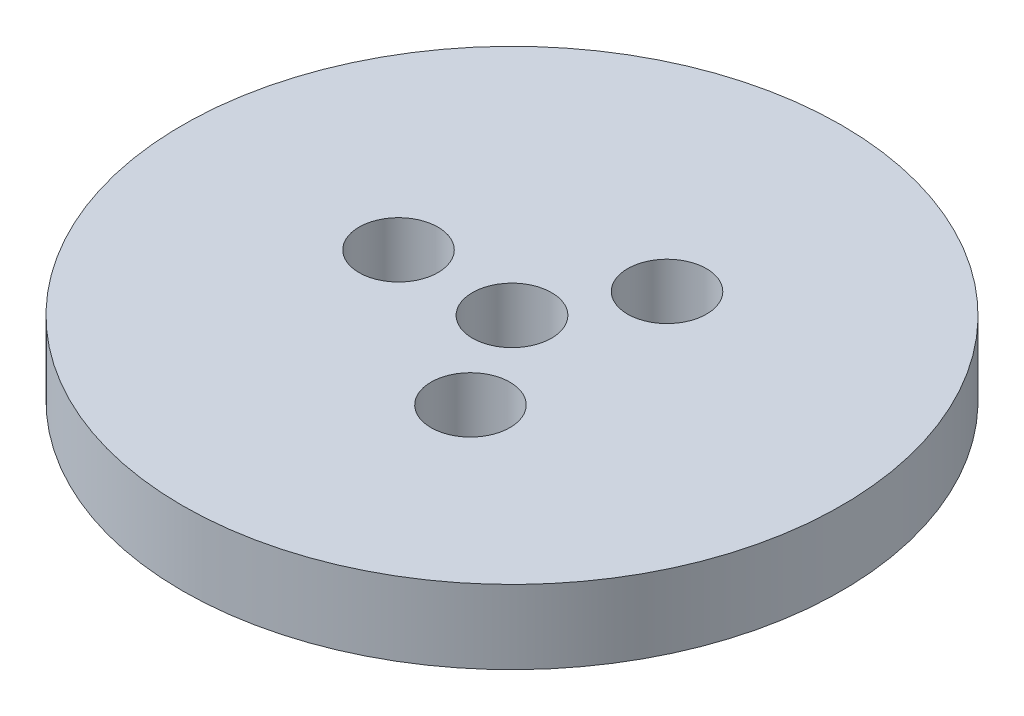
from build123d import *

# Parameters (mm, degrees)
SKETCH1_R           = 62.5
BOSS_EXTRUDE1_DEPTH = 14
SKETCH2_R           = 7.5
CUT_EXTRUDE1_DEPTH  = 90.49022293
SKETCH3_R           = 7.483126217
CUT_EXTRUDE2_DEPTH  = 13.000433881
CIRPATTERN1_COUNT   = 3


with BuildPart() as part:
    # Sketch1 → Boss-Extrude1 (new body)
    with BuildSketch(Plane(origin=(0, 0, 0), x_dir=(1, 0, 0), z_dir=(0, 1, 0))):
        Circle(SKETCH1_R)
    extrude(amount=BOSS_EXTRUDE1_DEPTH)

    # Sketch2 → Cut-Extrude1 (cut, through all)
    with BuildSketch(Plane(origin=(0, 0, 0), x_dir=(1, 0, 0), z_dir=(0, 1, 0))):
        Circle(SKETCH2_R)
    extrude(amount=CUT_EXTRUDE1_DEPTH, mode=Mode.SUBTRACT)

    # Sketch3 → Cut-Extrude2 (cut)
    with BuildSketch(Plane(origin=(0, 14, 0), x_dir=(1, 0, 0), z_dir=(0, 1, 0))):
        with Locations((-21.524422903, 0)):
            Circle(SKETCH3_R)
    cut_extrude2 = extrude(amount=-CUT_EXTRUDE2_DEPTH, mode=Mode.SUBTRACT)

    # CirPattern1: Cut-Extrude2 ×3 about axis
    cirpattern1_axis = Axis((0, 0, 0), (0, 1, 0))
    for i in range(1, CIRPATTERN1_COUNT):
        add(cut_extrude2.rotate(cirpattern1_axis, i * 360 / CIRPATTERN1_COUNT), mode=Mode.SUBTRACT)


solid = part.part
